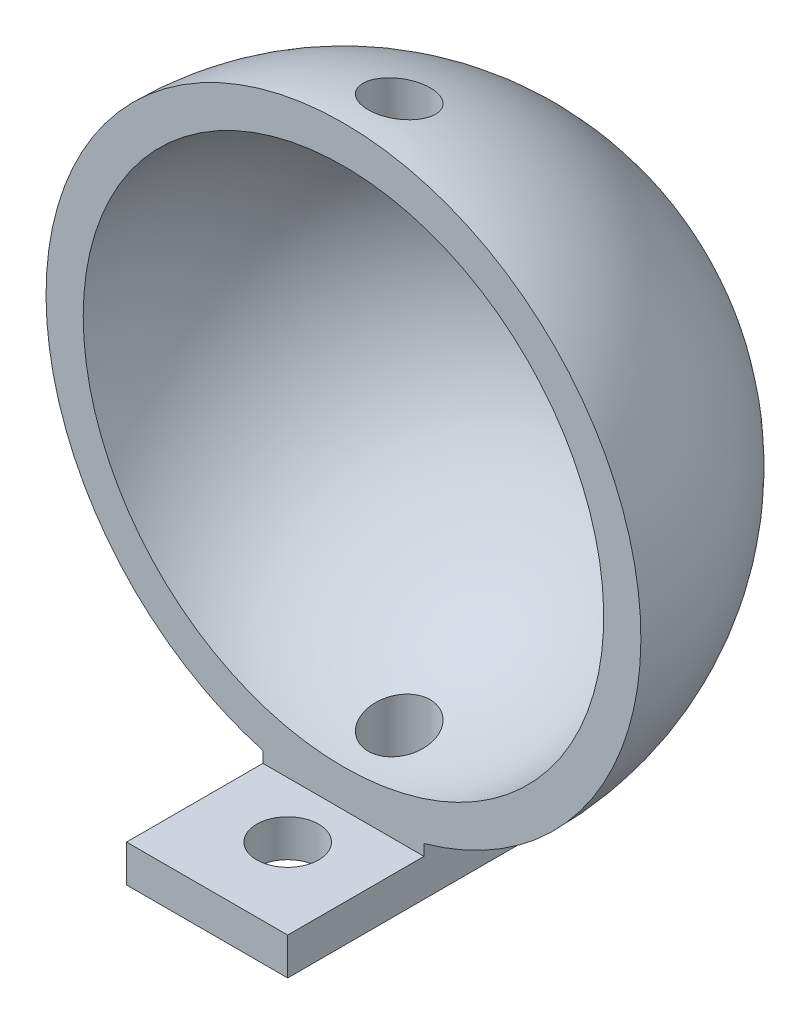
from build123d import *

# Parameters (mm, degrees)
SKETCH4_W                = 6.5
SKETCH4_H                = 11
SKETCH4_R                = 1.25
BOSS_EXTRUDE2_DEPTH      = 1.5
BOSS_EXTRUDE3_REACH      = 37.56
BOSS_EXTRUDE3_END_RADIUS = 10.5
SKETCH4_5_W              = 6.5
SKETCH4_5_H              = 5.5
SKETCH4_5_R              = 1.25
SKETCH4_6_R              = 1.25
CUT_EXTRUDE1_DEPTH       = 36.559862011


with BuildPart() as part:
    # Sketch4 → Boss-Extrude2 (new body)
    with BuildSketch(Plane(origin=(0, 60.25, 0), x_dir=(1, 0, 0), z_dir=(0, 1, 0))):
        with Locations((-2, 8.451253904)):
            Rectangle(SKETCH4_W, SKETCH4_H)
        with Locations((-2, 10.701253904)):
            Circle(SKETCH4_R, mode=Mode.SUBTRACT)
        with Locations((-2, 6.201253904)):
            Circle(SKETCH4_R, mode=Mode.SUBTRACT)
    extrude(amount=BOSS_EXTRUDE2_DEPTH)



with BuildPart() as body_2:
    # Sketch5 → Revolve5 (revolve)
    with BuildSketch(Plane.ZY.offset(2)):
        with BuildLine():
            Line((-8.451253904, 61.75), (-8.451253904, 63.25))
            ThreePointArc((-8.451253904, 63.25), (-15.875875106, 66.325378798), (-18.951253904, 73.75))
            Line((-18.951253904, 73.75), (-20.451253904, 73.75))
            ThreePointArc((-20.451253904, 73.75), (-16.936535278, 65.264718626), (-8.451253904, 61.75))
        make_face()
    revolve(axis=Axis((-2, 73.75, -18.951253904), (0, 0, 1)))


with BuildPart() as part_1:
    add(part.part)

    add(body_2.part)  # Boss-Extrude3 merges body 2
    # Boss-Extrude3: up to this sphere (the profile starts outside it)
    boss_extrude3_end = Location((-2, 73.75, -8.451253904)) * Sphere(BOSS_EXTRUDE3_END_RADIUS, mode=Mode.PRIVATE)
    # Sketch4<5> → Boss-Extrude3 (add, up to the surface)
    with BuildSketch(Plane(origin=(0, 60.25, 0), x_dir=(1, 0, 0), z_dir=(0, 1, 0)), mode=Mode.PRIVATE) as boss_extrude3_sk1:
        with Locations((-2, 11.201253904)):
            Rectangle(SKETCH4_5_W, SKETCH4_5_H)
        with Locations((-2, 10.701253904)):
            Circle(SKETCH4_5_R, mode=Mode.SUBTRACT)
    boss_extrude3_tool1 = extrude(boss_extrude3_sk1.sketch, amount=BOSS_EXTRUDE3_REACH, mode=Mode.PRIVATE) - boss_extrude3_end
    add(boss_extrude3_tool1.solids().sort_by_distance((-2, 60.25, -13.866107))[0])

    # Sketch4<6> → Cut-Extrude1 (cut, through all)
    with BuildSketch(Plane(origin=(0, 60.25, 0), x_dir=(1, 0, 0), z_dir=(0, 1, 0))):
        with Locations((-2, 10.701253904)):
            Circle(SKETCH4_6_R)
    extrude(amount=CUT_EXTRUDE1_DEPTH, mode=Mode.SUBTRACT)


solid = part_1.part
